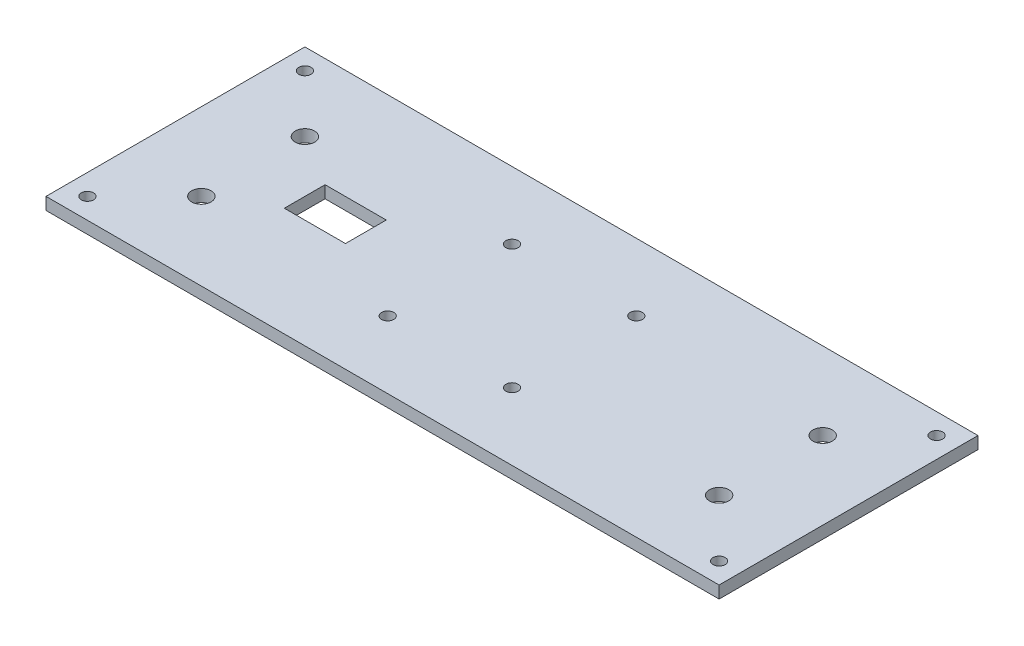
from build123d import *

# Parameters (mm, degrees)
SKETCH1_W           = 165.1
SKETCH1_H           = 63.5
BOSS_EXTRUDE1_DEPTH = 3
CUT_EXTRUDE1_REACH  = 90.496
SKETCH6_R           = 1.5
SKETCH6_W           = 15
SKETCH6_H           = 10
CUT_EXTRUDE2_REACH  = 90.496
SKETCH7_R           = 1.5
CUT_EXTRUDE3_REACH  = 90.496
SKETCH8_R           = 2.38125


with BuildPart() as part:
    # Sketch1 → Boss-Extrude1 (new body)
    with BuildSketch(Plane(origin=(0, 0, 0), x_dir=(1, 0, 0), z_dir=(0, 1, 0))):
        Rectangle(SKETCH1_W, SKETCH1_H)
    extrude(amount=BOSS_EXTRUDE1_DEPTH)

    # Sketch6 → Cut-Extrude1 (cut, up to next)
    with BuildSketch(Plane.XZ, mode=Mode.PRIVATE) as cut_extrude1_sk1:
        with Locations((-15.25, 15.25)):
            Circle(SKETCH6_R)
    cut_extrude1_tool1 = extrude(cut_extrude1_sk1.sketch, amount=-CUT_EXTRUDE1_REACH, mode=Mode.PRIVATE) & part.part
    # Sketch6 → Cut-Extrude1 (cut, up to next)
    with BuildSketch(Plane.XZ, mode=Mode.PRIVATE) as cut_extrude1_sk2:
        with Locations((15.25, 15.25)):
            Circle(SKETCH6_R)
    cut_extrude1_tool2 = extrude(cut_extrude1_sk2.sketch, amount=-CUT_EXTRUDE1_REACH, mode=Mode.PRIVATE) & part.part
    # Sketch6 → Cut-Extrude1 (cut, up to next)
    with BuildSketch(Plane.XZ, mode=Mode.PRIVATE) as cut_extrude1_sk3:
        with Locations((-15.25, -15.25)):
            Circle(SKETCH6_R)
    cut_extrude1_tool3 = extrude(cut_extrude1_sk3.sketch, amount=-CUT_EXTRUDE1_REACH, mode=Mode.PRIVATE) & part.part
    # Sketch6 → Cut-Extrude1 (cut, up to next)
    with BuildSketch(Plane.XZ, mode=Mode.PRIVATE) as cut_extrude1_sk4:
        with Locations((15.25, -15.25)):
            Circle(SKETCH6_R)
    cut_extrude1_tool4 = extrude(cut_extrude1_sk4.sketch, amount=-CUT_EXTRUDE1_REACH, mode=Mode.PRIVATE) & part.part
    # Sketch6 → Cut-Extrude1 (cut, up to next)
    with BuildSketch(Plane.XZ, mode=Mode.PRIVATE) as cut_extrude1_sk5:
        with Locations((-43.3, 0.047)):
            Rectangle(SKETCH6_W, SKETCH6_H)
    cut_extrude1_tool5 = extrude(cut_extrude1_sk5.sketch, amount=-CUT_EXTRUDE1_REACH, mode=Mode.PRIVATE) & part.part
    add(cut_extrude1_tool1.solids().sort_by_distance((-15.25, 0, 15.25))[0], mode=Mode.SUBTRACT)
    add(cut_extrude1_tool2.solids().sort_by_distance((15.25, 0, 15.25))[0], mode=Mode.SUBTRACT)
    add(cut_extrude1_tool3.solids().sort_by_distance((-15.25, 0, -15.25))[0], mode=Mode.SUBTRACT)
    add(cut_extrude1_tool4.solids().sort_by_distance((15.25, 0, -15.25))[0], mode=Mode.SUBTRACT)
    add(cut_extrude1_tool5.solids().sort_by_distance((-43.3, 0, 0.047))[0], mode=Mode.SUBTRACT)

    # Sketch7 → Cut-Extrude2 (cut, up to next)
    with BuildSketch(Plane(origin=(0, 3, 0), x_dir=(1, 0, 0), z_dir=(0, 1, 0)), mode=Mode.PRIVATE) as cut_extrude2_sk1:
        with Locations((-77.47, 26.67)):
            Circle(SKETCH7_R)
    cut_extrude2_tool1 = extrude(cut_extrude2_sk1.sketch, amount=-CUT_EXTRUDE2_REACH, mode=Mode.PRIVATE) & part.part
    # Sketch7 → Cut-Extrude2 (cut, up to next)
    with BuildSketch(Plane(origin=(0, 3, 0), x_dir=(1, 0, 0), z_dir=(0, 1, 0)), mode=Mode.PRIVATE) as cut_extrude2_sk2:
        with Locations((-77.47, -26.67)):
            Circle(SKETCH7_R)
    cut_extrude2_tool2 = extrude(cut_extrude2_sk2.sketch, amount=-CUT_EXTRUDE2_REACH, mode=Mode.PRIVATE) & part.part
    # Sketch7 → Cut-Extrude2 (cut, up to next)
    with BuildSketch(Plane(origin=(0, 3, 0), x_dir=(1, 0, 0), z_dir=(0, 1, 0)), mode=Mode.PRIVATE) as cut_extrude2_sk3:
        with Locations((77.47, -26.67)):
            Circle(SKETCH7_R)
    cut_extrude2_tool3 = extrude(cut_extrude2_sk3.sketch, amount=-CUT_EXTRUDE2_REACH, mode=Mode.PRIVATE) & part.part
    # Sketch7 → Cut-Extrude2 (cut, up to next)
    with BuildSketch(Plane(origin=(0, 3, 0), x_dir=(1, 0, 0), z_dir=(0, 1, 0)), mode=Mode.PRIVATE) as cut_extrude2_sk4:
        with Locations((77.47, 26.67)):
            Circle(SKETCH7_R)
    cut_extrude2_tool4 = extrude(cut_extrude2_sk4.sketch, amount=-CUT_EXTRUDE2_REACH, mode=Mode.PRIVATE) & part.part
    add(cut_extrude2_tool1.solids().sort_by_distance((-77.47, 3, -26.67))[0], mode=Mode.SUBTRACT)
    add(cut_extrude2_tool2.solids().sort_by_distance((-77.47, 3, 26.67))[0], mode=Mode.SUBTRACT)
    add(cut_extrude2_tool3.solids().sort_by_distance((77.47, 3, 26.67))[0], mode=Mode.SUBTRACT)
    add(cut_extrude2_tool4.solids().sort_by_distance((77.47, 3, -26.67))[0], mode=Mode.SUBTRACT)

    # Sketch8 → Cut-Extrude3 (cut, up to next)
    with BuildSketch(Plane(origin=(0, 3, 0), x_dir=(1, 0, 0), z_dir=(0, 1, 0)), mode=Mode.PRIVATE) as cut_extrude3_sk1:
        with Locations((-63.5, -12.7)):
            Circle(SKETCH8_R)
    cut_extrude3_tool1 = extrude(cut_extrude3_sk1.sketch, amount=-CUT_EXTRUDE3_REACH, mode=Mode.PRIVATE) & part.part
    # Sketch8 → Cut-Extrude3 (cut, up to next)
    with BuildSketch(Plane(origin=(0, 3, 0), x_dir=(1, 0, 0), z_dir=(0, 1, 0)), mode=Mode.PRIVATE) as cut_extrude3_sk2:
        with Locations((-63.5, 12.7)):
            Circle(SKETCH8_R)
    cut_extrude3_tool2 = extrude(cut_extrude3_sk2.sketch, amount=-CUT_EXTRUDE3_REACH, mode=Mode.PRIVATE) & part.part
    # Sketch8 → Cut-Extrude3 (cut, up to next)
    with BuildSketch(Plane(origin=(0, 3, 0), x_dir=(1, 0, 0), z_dir=(0, 1, 0)), mode=Mode.PRIVATE) as cut_extrude3_sk3:
        with Locations((63.5, 12.7)):
            Circle(SKETCH8_R)
    cut_extrude3_tool3 = extrude(cut_extrude3_sk3.sketch, amount=-CUT_EXTRUDE3_REACH, mode=Mode.PRIVATE) & part.part
    # Sketch8 → Cut-Extrude3 (cut, up to next)
    with BuildSketch(Plane(origin=(0, 3, 0), x_dir=(1, 0, 0), z_dir=(0, 1, 0)), mode=Mode.PRIVATE) as cut_extrude3_sk4:
        with Locations((63.5, -12.7)):
            Circle(SKETCH8_R)
    cut_extrude3_tool4 = extrude(cut_extrude3_sk4.sketch, amount=-CUT_EXTRUDE3_REACH, mode=Mode.PRIVATE) & part.part
    add(cut_extrude3_tool1.solids().sort_by_distance((-63.5, 3, 12.7))[0], mode=Mode.SUBTRACT)
    add(cut_extrude3_tool2.solids().sort_by_distance((-63.5, 3, -12.7))[0], mode=Mode.SUBTRACT)
    add(cut_extrude3_tool3.solids().sort_by_distance((63.5, 3, -12.7))[0], mode=Mode.SUBTRACT)
    add(cut_extrude3_tool4.solids().sort_by_distance((63.5, 3, 12.7))[0], mode=Mode.SUBTRACT)


solid = part.part
